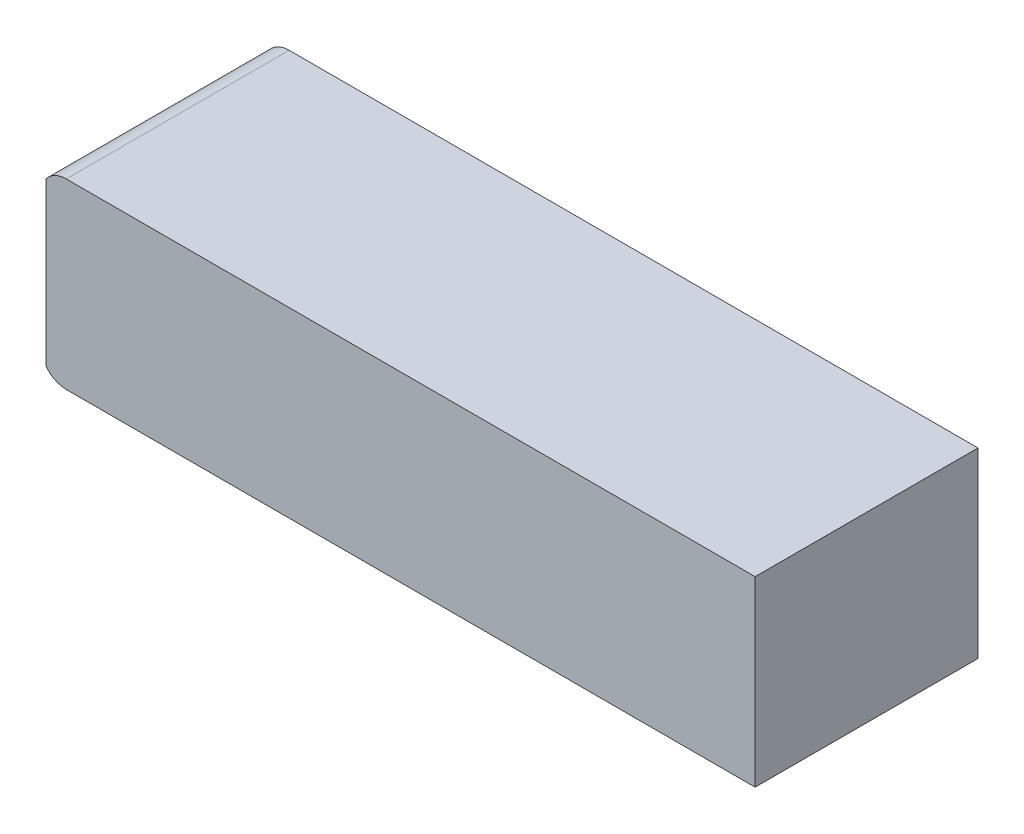
from build123d import *

# Parameters (mm, degrees)
SKETCH_1_W      = 141
SKETCH_1_H      = 44
EXTRUDE_1_DEPTH = 36
FILLET_1_R      = 5


with BuildPart() as part:
    # 草图1 → 凸台-拉伸1 (new body)
    with BuildSketch(Plane(origin=(0, 0, 0), x_dir=(1, 0, 0), z_dir=(0, 1, 0))):
        Rectangle(SKETCH_1_W, SKETCH_1_H)
    extrude(amount=EXTRUDE_1_DEPTH)

    # 圆角1
    fillet_1_edges = [part.edges().sort_by_distance(p)[0] for p in [
        (-70.5, 36, 0),
        (-70.5, 0, 0),
    ]]
    fillet(fillet_1_edges, radius=FILLET_1_R)

    # 倒角1
    # the kernel refuses this chamfer: 1 mm, written as the material it takes off along each edge
    with BuildSketch(Plane(origin=(-70.5, -1.172039171, 22), x_dir=(0.9996219169112968, 0, 0.02749587661058574), z_dir=(0, 1, 0))) as chamfer_1_piece_1:
        with BuildLine():
            Line((1.028673195, 0), (-0.056547155, 1.027117794))
            Line((-0.056547155, 1.027117794), (-0.076539593, 1.026567876))
            ThreePointArc((-0.076539593, 1.026567876), (-0.034129227, 0.51339783), (-0.019992438, -0.000549918))
            Line((-0.019992438, -0.000549918), (0.000549918, -0.019992438))
            ThreePointArc((0.000549918, -0.019992438), (0.514497665, -0.00585565), (1.029223113, -0.019992438))
            Line((1.029223113, -0.019992438), (1.028673195, 0))
        make_face()
    extrude(amount=38.344078342, mode=Mode.SUBTRACT)


solid = part.part
